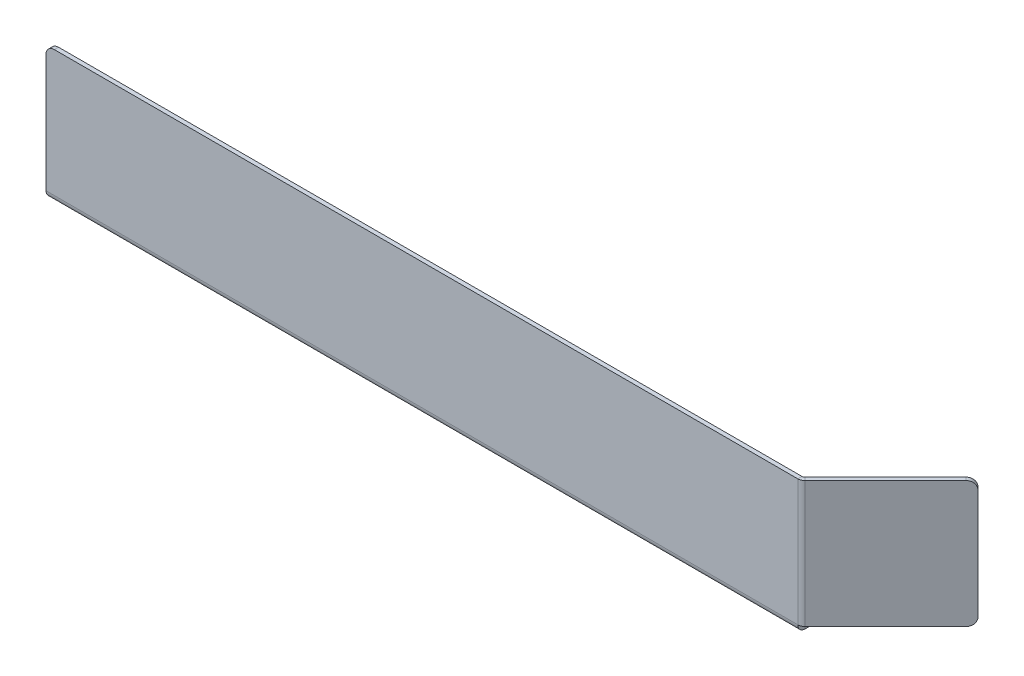
from build123d import *

# Parameters (mm, degrees)
SKETCH2_W                    = 180
SKETCH2_H                    = 32
BASE_FLANGE1_DEPTH           = 1
EDGE_FLANGE1_STRIP_W         = 5.4732
EDGE_FLANGE1_STRIP_H         = 1
EDGE_FLANGE1_STRIP_CUT_DEPTH = 180
EDGE_FLANGE1_DEPTH           = 180
EDGE_FLANGE2_DEPTH           = 30.2634
FILLET1_R                    = 2


# Sheet-metal steps are written as plain solids
with BuildPart() as part:
    # Sketch2 → Base-Flange1 (new body)
    with BuildSketch(Plane.XY):
        with Locations((-90, 16)):
            Rectangle(SKETCH2_W, SKETCH2_H)
    extrude(amount=-BASE_FLANGE1_DEPTH)

    # Edge-Flange1 strip (across the edge) → Edge-Flange1 strip cut (cut)
    with BuildSketch(Plane(origin=(0, 0, -1), x_dir=(0, 1, 0), z_dir=(-1, 0, 0))):
        with Locations((-1, -0.5)):
            Rectangle(EDGE_FLANGE1_STRIP_W, EDGE_FLANGE1_STRIP_H)
    extrude(amount=EDGE_FLANGE1_STRIP_CUT_DEPTH, mode=Mode.SUBTRACT)

    # Edge-Flange1 section (across the edge) → Edge-Flange1 (add)
    with BuildSketch(Plane(origin=(0, 0, -1), x_dir=(0, 1, 0), z_dir=(-1, 0, 0))):
        with BuildLine():
            Line((0, 0.7366), (0, 17))
            Line((0, 17), (1, 17))
            Line((1, 17), (1, 0.7366))
            ThreePointArc((1, 0.7366), (1.215745145, 0.215745145), (1.7366, 0))
            Line((1.7366, 0), (1.7366, -1))
            ThreePointArc((1.7366, -1), (0.508638364, -0.491361636), (0, 0.7366))
        make_face()
    extrude(amount=EDGE_FLANGE1_DEPTH)

    # Edge-Flange2 section (across the edge) → Edge-Flange2 (add)
    with BuildSketch(Plane(origin=(0.30510971, 32, -1), x_dir=(-0.7071067811865438, 0, -0.7071067811865512), z_dir=(0, -1, 0))):
        with BuildLine():
            Line((-1, 0.30510971), (-1, 29.585786438))
            Line((-1, 29.585786438), (0, 29.585786438))
            Line((0, 29.585786438), (0, 0.30510971))
            ThreePointArc((0, 0.30510971), (0.056070336, 0.023225094), (0.215745145, -0.215745145))
            Line((0.215745145, -0.215745145), (-0.491361636, -0.922851926))
            ThreePointArc((-0.491361636, -0.922851926), (-0.867809196, -0.359458339), (-1, 0.30510971))
        make_face()
    extrude(amount=EDGE_FLANGE2_DEPTH)

    # Fillet1
    fillet1_edges = [part.edges().sort_by_distance(p)[0] for p in [
        (0, 0.5, -18),
        (-180, 0.5, -18),
        (21.578973317, 32, -21.566756826),
        (21.578973317, 1.7366, -21.566756826),
        (-180, 32, -0.5),
    ]]
    fillet(fillet1_edges, radius=FILLET1_R)


solid = part.part
